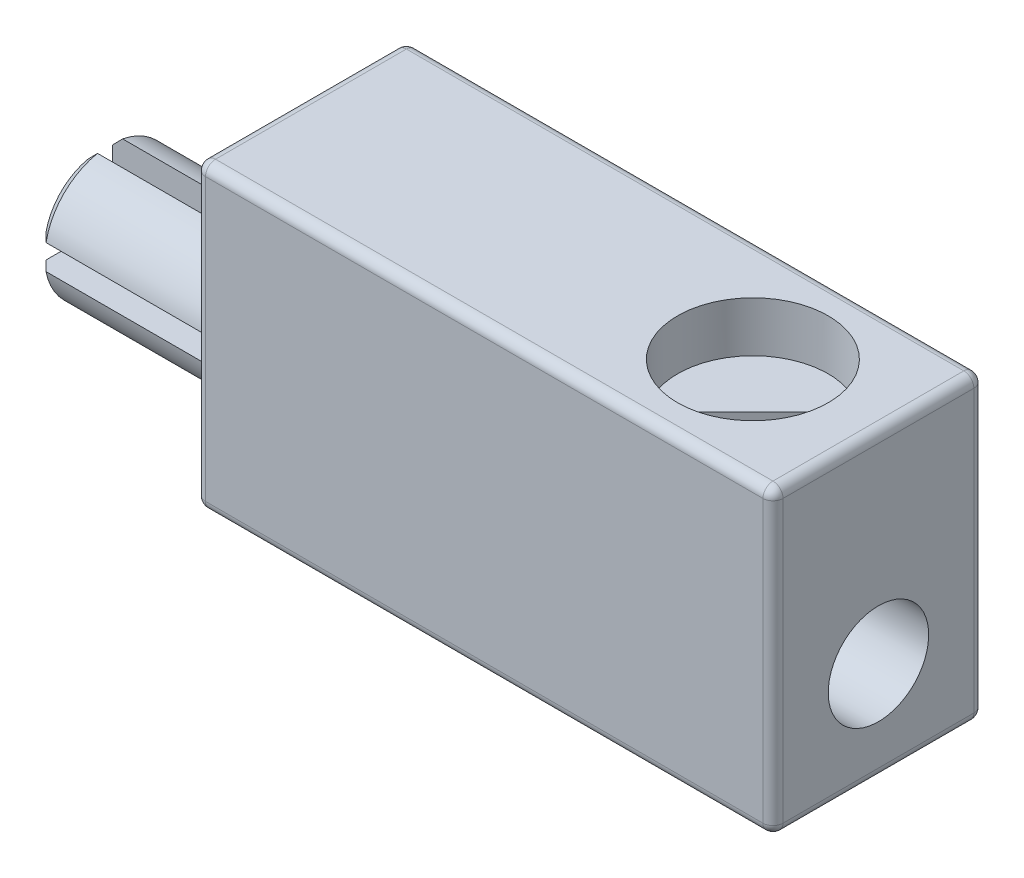
from build123d import *
from build123d.topology import SkipClean

# Parameters (mm, degrees)
SKETCH_1_W          = 11.5
SKETCH_1_H          = 6
EXTRUDE_1_DEPTH     = 4.2
SKETCH_2_R          = 1.5
CUT_EXTRUDE_1_DEPTH = 2
SKETCH_3_R          = 1.3
EXTRUDE_2_DEPTH     = 6
CHAMFER_1_SIZE      = 0.2
CUT_EXTRUDE_START   = -5
CUT_EXTRUDE_2_DEPTH = 5
SKETCH_5_R          = 1
CUT_EXTRUDE_3_DEPTH = 9
SKETCH_6_R          = 1.3
CUT_EXTRUDE_4_DEPTH = 2
SKETCH_7_R          = 1.5
CUT_EXTRUDE_5_DEPTH = 1
CUT_EXTRUDE_6_DEPTH = 0.5
EXTRUDE_START       = -3
SKETCH_9_R          = 0.7
EXTRUDE_3_DEPTH     = 1.6
FILLET_1_R          = 0.2


with BuildPart() as part:
    # 草图1 → 凸台-拉伸1 (new body)
    with BuildSketch(Plane.XY):
        with Locations((5.75, 3)):
            Rectangle(SKETCH_1_W, SKETCH_1_H)
    extrude(amount=EXTRUDE_1_DEPTH)

    # 草图2 → 切除-拉伸1 (cut)
    with BuildSketch(Plane.ZY):
        with Locations((2.1, 2)):
            Circle(SKETCH_2_R)
    extrude(amount=-CUT_EXTRUDE_1_DEPTH, mode=Mode.SUBTRACT)

    # 草图3 → 凸台-拉伸2 (add)
    with BuildSketch(Plane.ZY.offset(-2)):
        with Locations((2.1, 2)):
            Circle(SKETCH_3_R)
    extrude(amount=EXTRUDE_2_DEPTH)

    # 倒角1
    chamfer_1_edges = [part.edges().sort_by_distance(p)[0] for p in [
        (-4, 2, 0.8),
    ]]
    chamfer(chamfer_1_edges, length=CHAMFER_1_SIZE)

    # 草图4 → 切除-拉伸2 (cut)
    with BuildSketch(Plane.ZY.offset(4).offset(CUT_EXTRUDE_START)):
        with BuildLine():
            Line((1.85, 3.275735082), (1.85, 2.25))
            Line((1.85, 2.25), (0.824264918, 2.25))
            ThreePointArc((0.824264918, 2.25), (0.8, 2), (0.824264918, 1.75))
            Line((0.824264918, 1.75), (1.85, 1.75))
            Line((1.85, 1.75), (1.85, 0.724264918))
            ThreePointArc((1.85, 0.724264918), (2.1, 0.7), (2.35, 0.724264918))
            Line((2.35, 0.724264918), (2.35, 1.75))
            Line((2.35, 1.75), (3.375735082, 1.75))
            ThreePointArc((3.375735082, 1.75), (3.4, 2), (3.375735082, 2.25))
            Line((3.375735082, 2.25), (2.35, 2.25))
            Line((2.35, 2.25), (2.35, 3.275735082))
            ThreePointArc((2.35, 3.275735082), (2.1, 3.3), (1.85, 3.275735082))
        make_face()
    extrude(amount=CUT_EXTRUDE_2_DEPTH, mode=Mode.SUBTRACT)

    # 草图5 → 切除-拉伸3 (cut)
    with BuildSketch(Plane(origin=(11.5, 0, 0), x_dir=(0, 0, -1), z_dir=(1, 0, 0))):
        with Locations((-2.1, 2)):
            Circle(SKETCH_5_R)
    extrude(amount=-CUT_EXTRUDE_3_DEPTH, mode=Mode.SUBTRACT)

    # 草图6 → 切除-拉伸4 (cut)
    with BuildSketch(Plane.XZ):
        with Locations((4.5, 2.1)):
            Circle(SKETCH_6_R)
    extrude(amount=-CUT_EXTRUDE_4_DEPTH, mode=Mode.SUBTRACT)

    # 草图7 → 切除-拉伸5 (cut)
    with BuildSketch(Plane(origin=(0, 6, 0), x_dir=(1, 0, 0), z_dir=(0, 1, 0))):
        with Locations((9, -2.1)):
            Circle(SKETCH_7_R)
    extrude(amount=-CUT_EXTRUDE_5_DEPTH, mode=Mode.SUBTRACT)

    # 草图8 → 切除-拉伸6 (cut)
    with SkipClean():  # the faces are left unmerged after this step: merging them gives an invalid solid
        with BuildSketch(Plane(origin=(0, 5, 0), x_dir=(1, 0, 0), z_dir=(0, 1, 0))):
            with BuildLine():
                Line((9.088388348, -2.188388348), (8.03141744, -3.245359255))
                ThreePointArc((8.03141744, -3.245359255), (7.939339828, -3.160660172), (7.854640745, -3.06858256))
                Line((7.854640745, -3.06858256), (8.911611652, -2.011611652))
                Line((8.911611652, -2.011611652), (9.96858256, -0.954640745))
                ThreePointArc((9.96858256, -0.954640745), (10.060660172, -1.039339828), (10.145359255, -1.13141744))
                Line((10.145359255, -1.13141744), (9.088388348, -2.188388348))
            make_face()
        extrude(amount=-CUT_EXTRUDE_6_DEPTH, mode=Mode.SUBTRACT)

    # 草图9 → 凸台-拉伸3 (add)
    with SkipClean():  # the faces are left unmerged after this step: merging them gives an invalid solid
        with BuildSketch(Plane(origin=(0, 6, 0), x_dir=(1, 0, 0), z_dir=(0, 1, 0)).offset(EXTRUDE_START)):
            with Locations((9, -2.1)):
                Circle(SKETCH_9_R)
        extrude(amount=-EXTRUDE_3_DEPTH)

    # 圆角1
    fillet_1_edges = [part.edges().sort_by_distance(p)[0] for p in [
        (0, 0, 2.1),
        (0, 3, 0),
        (5.75, 6, 0),
        (5.75, 0, 0),
        (11.5, 3, 0),
        (11.5, 0, 2.1),
        (11.5, 6, 2.1),
        (11.5, 3, 4.2),
        (5.75, 0, 4.2),
        (5.75, 6, 4.2),
        (0, 6, 2.1),
        (0, 3, 4.2),
    ]]
    fillet(fillet_1_edges, radius=FILLET_1_R)


solid = part.part
